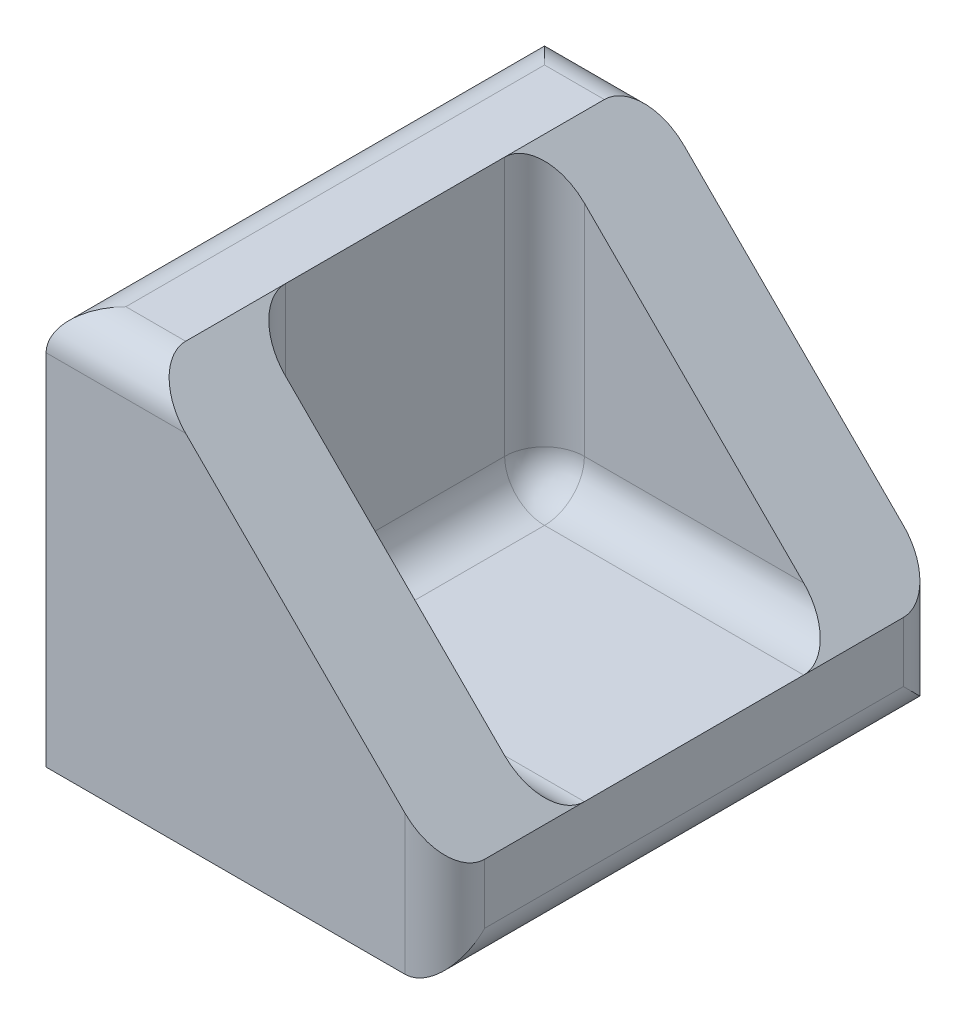
from build123d import *

# Parameters (mm, degrees)
BOSS_EXTRUDE2_DEPTH = 25
SHELL1_START        = 5
SHELL1_OUTLINE_W    = 16
SHELL1_OUTLINE_H    = 15
SHELL1_DEPTH        = 15
FILLET1_R           = 2
FILLET3_R           = 2


# Read off the part's stored shape, not the designer's step: Shell1
with BuildPart() as part:
    # Sketch1 → Boss-Extrude2 (new body)
    with BuildSketch(Plane.XY):
        Polygon((0, 0), (0, 20), (5, 20), (20, 5), (20, 0), align=None)
    extrude(amount=-BOSS_EXTRUDE2_DEPTH)

    # Shell1 outline → Shell1 (cut)
    with BuildSketch(Plane(origin=(0, 0, 0), x_dir=(1, 0, 0), z_dir=(0, 1, 0)).offset(SHELL1_START)):
        with Locations((13, 12.5)):
            Rectangle(SHELL1_OUTLINE_W, SHELL1_OUTLINE_H)
    extrude(amount=SHELL1_DEPTH, mode=Mode.SUBTRACT)

    # Fillet1
    fillet1_edges = [part.edges().sort_by_distance(p)[0] for p in [
        (12.5, 5, -20),
        (5, 12.5, -20),
        (5, 5, -12.5),
        (12.5, 5, -5),
        (5, 12.5, -5),
    ]]
    fillet(fillet1_edges, radius=FILLET1_R)

    # Fillet3
    fillet3_edges = [part.edges().sort_by_distance(p)[0] for p in [
        (2.5, 20, -25),
        (2.5, 20, 0),
        (20, 2.5, 0),
        (20, 2.5, -25),
        (0, 20, -12.5),
        (20, 0, -12.5),
    ]]
    fillet(fillet3_edges, radius=FILLET3_R)


solid = part.part
